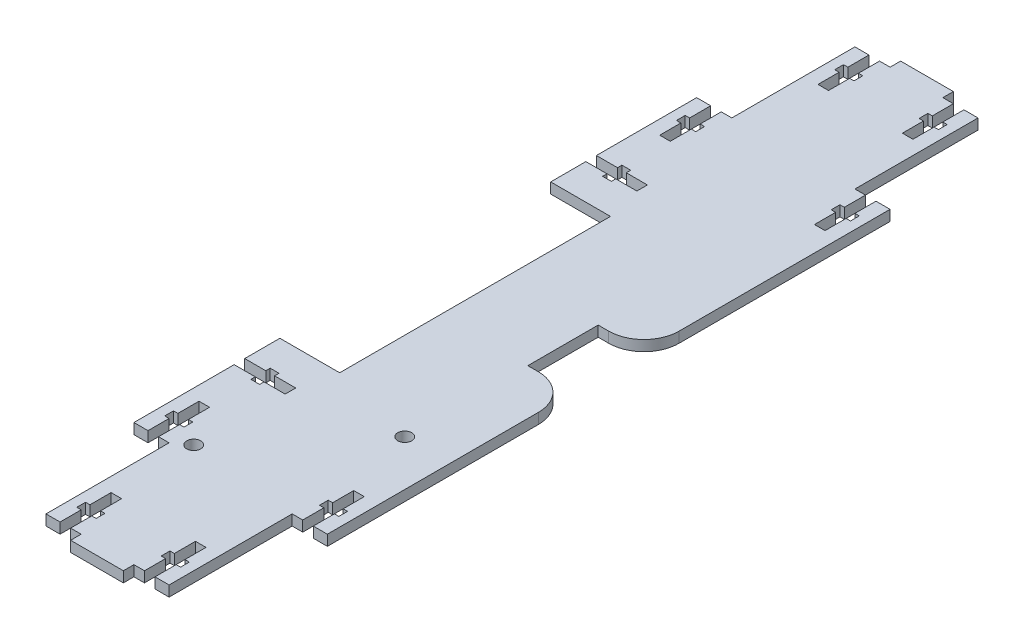
from build123d import *

# Parameters (mm, degrees)
SKETCH_1_W           = 55
SKETCH_1_H           = 160
EXTRUDE_1_DEPTH      = 3
EXTRUDE_2_DEPTH      = 35
EXTRUDE_2_DEPTH_BACK = 195
SKETCH_2_W           = 35
SKETCH_2_H           = 3
EXTRUDE_3_DEPTH      = 3
EXTRUDE_3_DEPTH_BACK = 233
SKETCH_3_W           = 15
SKETCH_3_H           = 3
CUT_EXTRUDE_1_DEPTH  = 3
CUT_EXTRUDE_2_DEPTH  = 3
SKETCH_6_W           = 77
SKETCH_6_H           = 3
CUT_EXTRUDE_3_DEPTH  = 17
SKETCH_8_R           = 2
CUT_EXTRUDE_4_DEPTH  = 3
SKETCH_9_W           = 13
SKETCH_9_H           = 20
CUT_EXTRUDE_5_DEPTH  = 3
FILLET_1_R           = 10


with BuildPart() as part:
    # Эскиз1 → Бобышка-Вытянуть1 (new body)
    with BuildSketch(Plane(origin=(0, 0, 0), x_dir=(1, 0, 0), z_dir=(0, 1, 0))):
        Rectangle(SKETCH_1_W, SKETCH_1_H)
    extrude(amount=EXTRUDE_1_DEPTH)

    # Эскиз2 → Бобышка-Вытянуть2 (add, two sides: drawn at the far end of the back side and taken through both)
    with BuildSketch(Plane(origin=(0, 0, -80), x_dir=(-1, 0, 0), z_dir=(0, 0, -1)).offset(-EXTRUDE_2_DEPTH_BACK)):
        with Locations((0, 1.5)):
            Rectangle(SKETCH_2_W, SKETCH_2_H)
    extrude(amount=EXTRUDE_2_DEPTH + EXTRUDE_2_DEPTH_BACK)

    # Эскиз3 → Бобышка-Вытянуть3 (add, two sides: drawn at the far end of the back side and taken through both)
    with BuildSketch(Plane(origin=(0, 0, -115), x_dir=(-1, 0, 0), z_dir=(0, 0, -1)).offset(-EXTRUDE_3_DEPTH_BACK)):
        with Locations((0, 1.5)):
            Rectangle(SKETCH_3_W, SKETCH_3_H)
    extrude(amount=EXTRUDE_3_DEPTH + EXTRUDE_3_DEPTH_BACK)

    # Эскиз4 → Вырез-Вытянуть1 (cut)
    with BuildSketch(Plane(origin=(0, 3, 0), x_dir=(1, 0, 0), z_dir=(0, 1, 0))):
        Polygon((-23.5, 80), (-23.5, 74), (-24.75, 74), (-24.75, 71.5), (-23.5, 71.5), (-23.5, 65.5), (-20.5, 65.5), (-20.5, 71.5), (-19.25, 71.5), (-19.25, 74), (-20.5, 74), (-20.5, 80), align=None)
        Polygon((-13.5, 115), (-13.5, 109), (-14.75, 109), (-14.75, 106.5), (-13.5, 106.5), (-13.5, 100.5), (-10.5, 100.5), (-10.5, 106.5), (-9.25, 106.5), (-9.25, 109), (-10.5, 109), (-10.5, 115), align=None)
        Polygon((10.5, 115), (13.5, 115), (13.5, 109), (14.75, 109), (14.75, 106.5), (13.5, 106.5), (13.5, 100.5), (10.5, 100.5), (10.5, 106.5), (9.25, 106.5), (9.25, 109), (10.5, 109), align=None)
        Polygon((20.5, 80), (23.5, 80), (23.5, 74), (24.75, 74), (24.75, 71.5), (23.5, 71.5), (23.5, 65.5), (20.5, 65.5), (20.5, 71.5), (19.25, 71.5), (19.25, 74), (20.5, 74), align=None)
        Polygon((-10.5, -115), (-13.5, -115), (-13.5, -109), (-14.75, -109), (-14.75, -106.5), (-13.5, -106.5), (-13.5, -100.5), (-10.5, -100.5), (-10.5, -106.5), (-9.25, -106.5), (-9.25, -109), (-10.5, -109), align=None)
        Polygon((13.5, -115), (13.5, -109), (14.75, -109), (14.75, -106.5), (13.5, -106.5), (13.5, -100.5), (10.5, -100.5), (10.5, -106.5), (9.25, -106.5), (9.25, -109), (10.5, -109), (10.5, -115), align=None)
        Polygon((-20.5, -80), (-23.5, -80), (-23.5, -74), (-24.75, -74), (-24.75, -71.5), (-23.5, -71.5), (-23.5, -65.5), (-20.5, -65.5), (-20.5, -71.5), (-19.25, -71.5), (-19.25, -74), (-20.5, -74), align=None)
        Polygon((23.5, -80), (23.5, -74), (24.75, -74), (24.75, -71.5), (23.5, -71.5), (23.5, -65.5), (20.5, -65.5), (20.5, -71.5), (19.25, -71.5), (19.25, -74), (20.5, -74), (20.5, -80), align=None)
    extrude(amount=-CUT_EXTRUDE_1_DEPTH, mode=Mode.SUBTRACT)

    # Эскиз5 → Вырез-Вытянуть2 (cut)
    with BuildSketch(Plane(origin=(0, 3, 0), x_dir=(1, 0, 0), z_dir=(0, 1, 0))):
        Polygon((-27.5, 51.5), (-21.5, 51.5), (-21.5, 52.75), (-19, 52.75), (-19, 51.5), (-13, 51.5), (-13, 48.5), (-19, 48.5), (-19, 47.25), (-21.5, 47.25), (-21.5, 48.5), (-27.5, 48.5), align=None)
        Polygon((-27.5, -48.5), (-27.5, -51.5), (-21.5, -51.5), (-21.5, -52.75), (-19, -52.75), (-19, -51.5), (-13, -51.5), (-13, -48.5), (-19, -48.5), (-19, -47.25), (-21.5, -47.25), (-21.5, -48.5), align=None)
    extrude(amount=-CUT_EXTRUDE_2_DEPTH, mode=Mode.SUBTRACT)

    # Эскиз6 → Вырез-Вытянуть3 (cut)
    with BuildSketch(Plane.ZY.offset(27.5)):
        with Locations((0, 1.5)):
            Rectangle(SKETCH_6_W, SKETCH_6_H)
    extrude(amount=-CUT_EXTRUDE_3_DEPTH, mode=Mode.SUBTRACT)

    # Эскиз8 → Вырез-Вытянуть4 (cut)
    with BuildSketch(Plane(origin=(0, 3, 0), x_dir=(1, 0, 0), z_dir=(0, 1, 0))):
        with Locations((-13.5, -77)):
            Circle(SKETCH_8_R)
        with Locations((14.5, -45)):
            Circle(SKETCH_8_R)
    extrude(amount=-CUT_EXTRUDE_4_DEPTH, mode=Mode.SUBTRACT)

    # Эскиз9 → Вырез-Вытянуть5 (cut)
    with BuildSketch(Plane(origin=(0, 3, 0), x_dir=(1, 0, 0), z_dir=(0, 1, 0))):
        with Locations((21, 0)):
            Rectangle(SKETCH_9_W, SKETCH_9_H)
    extrude(amount=-CUT_EXTRUDE_5_DEPTH, mode=Mode.SUBTRACT)

    # Скругление1
    fillet_1_edges = [part.edges().sort_by_distance(p)[0] for p in [
        (27.5, 1.5, 10),
        (27.5, 1.5, -10),
    ]]
    fillet(fillet_1_edges, radius=FILLET_1_R)


solid = part.part
